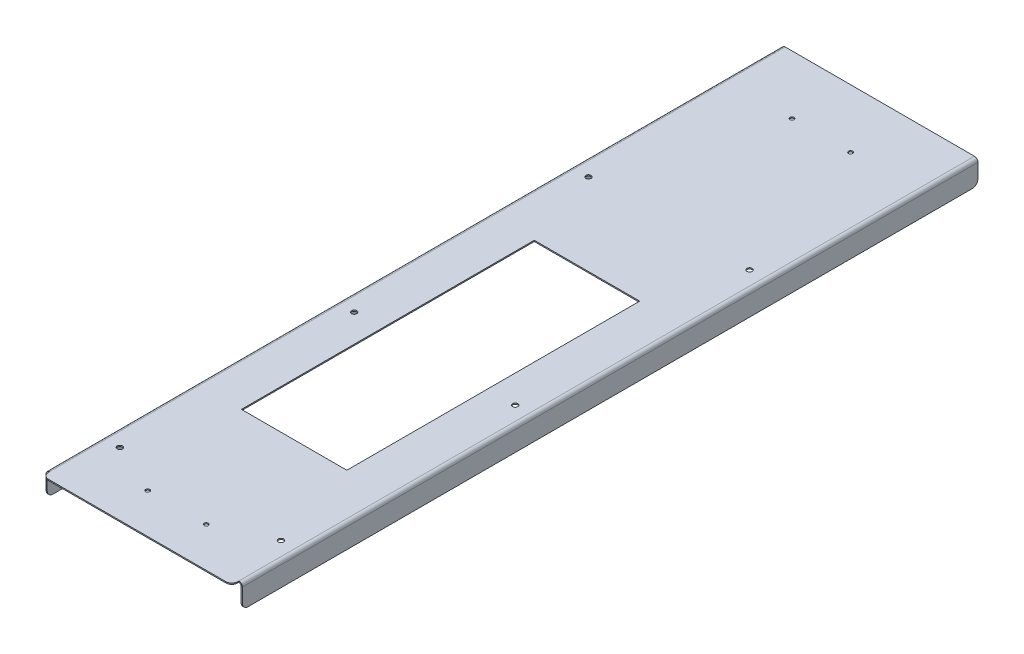
from build123d import *

# Parameters (mm, degrees)
SKETCH_1_W                  = 323
SKETCH_1_H                  = 1268
SKETCH_1_R                  = 4.5
SKETCH_1_R_2                = 3.5
SKETCH_1_W_2                = 180
SKETCH_1_H_2                = 500
SM_BASE_FLANGE_1_DEPTH      = 2
SM_EDGE_FLANGE_1_DEPTH      = 1256
SM_EDGE_FLANGE_1_BEND_DEPTH = 1256
FILLET_1_R                  = 10
FILLET_2_R                  = 10


# Sheet-metal steps are written as plain solids
with BuildPart() as part:
    # Sketch 1 → Базовая кромка1 (new body)
    with BuildSketch(Plane(origin=(0, 0, 0), x_dir=(1, 0, 0), z_dir=(0, 1, 0))):
        Rectangle(SKETCH_1_W, SKETCH_1_H)
        with Locations(Location((-137.5, -526, 0), (0, 0, 270))):
            Circle(SKETCH_1_R, mode=Mode.SUBTRACT)
        with Locations(Location((137.5, -526, 0), (0, 0, 270))):
            Circle(SKETCH_1_R, mode=Mode.SUBTRACT)
        with Locations(Location((-137.5, -126, 0), (0, 0, 270))):
            Circle(SKETCH_1_R, mode=Mode.SUBTRACT)
        with Locations(Location((137.5, -126, 0), (0, 0, 270))):
            Circle(SKETCH_1_R, mode=Mode.SUBTRACT)
        with Locations(Location((-137.5, 274, 0), (0, 0, 270))):
            Circle(SKETCH_1_R, mode=Mode.SUBTRACT)
        with Locations(Location((137.5, 274, 0), (0, 0, 270))):
            Circle(SKETCH_1_R, mode=Mode.SUBTRACT)
        with Locations(Location((-50, -566, 0), (0, 0, 270))):
            Circle(SKETCH_1_R_2, mode=Mode.SUBTRACT)
        with Locations(Location((50, -566, 0), (0, 0, 270))):
            Circle(SKETCH_1_R_2, mode=Mode.SUBTRACT)
        with Locations(Location((-50, 534, 0), (0, 0, 270))):
            Circle(SKETCH_1_R_2, mode=Mode.SUBTRACT)
        with Locations(Location((50, 534, 0), (0, 0, 270))):
            Circle(SKETCH_1_R_2, mode=Mode.SUBTRACT)
        with Locations((0, -116)):
            Rectangle(SKETCH_1_W_2, SKETCH_1_H_2, mode=Mode.SUBTRACT)
    extrude(amount=-SM_BASE_FLANGE_1_DEPTH)

    # Ребро-кромка1 section (across the edge) → Ребро-кромка1 (add)
    with BuildSketch(Plane(origin=(165.5, -2, -634), x_dir=(-1, 0, 0), z_dir=(0, 0, 1))):
        with BuildLine():
            Line((-2, 4), (-2, 38))
            Line((-2, 38), (0, 38))
            Line((0, 38), (0, 4))
            ThreePointArc((0, 4), (1.171572875, 1.171572875), (4, 0))
            Line((4, 0), (4, -2))
            ThreePointArc((4, -2), (-0.242640687, -0.242640687), (-2, 4))
        make_face()
    extrude(amount=SM_EDGE_FLANGE_1_DEPTH)

    # Ребро-кромка1 section 2 (across the edge) → Ребро-кромка1 bend (add)
    with BuildSketch(Plane(origin=(-165.5, -2, 622), x_dir=(1, 0, 0), z_dir=(0, 0, -1))):
        with BuildLine():
            Line((-2, 4), (-2, 38))
            Line((-2, 38), (0, 38))
            Line((0, 38), (0, 4))
            ThreePointArc((0, 4), (1.171572875, 1.171572875), (4, 0))
            Line((4, 0), (4, -2))
            ThreePointArc((4, -2), (-0.242640687, -0.242640687), (-2, 4))
        make_face()
    extrude(amount=SM_EDGE_FLANGE_1_BEND_DEPTH)

    # Скругление1
    fillet_1_edges = [part.edges().sort_by_distance(p)[0] for p in [
        (-166.5, -40, 622),
        (-166.5, -40, -634),
        (166.5, -40, -634),
        (166.5, -40, 622),
    ]]
    fillet(fillet_1_edges, radius=FILLET_1_R)

    # Скругление2
    fillet_2_edges = [part.edges().sort_by_distance(p)[0] for p in [
        (161.5, -1, 634),
        (-161.5, -1, 634),
    ]]
    fillet(fillet_2_edges, radius=FILLET_2_R)


solid = part.part
